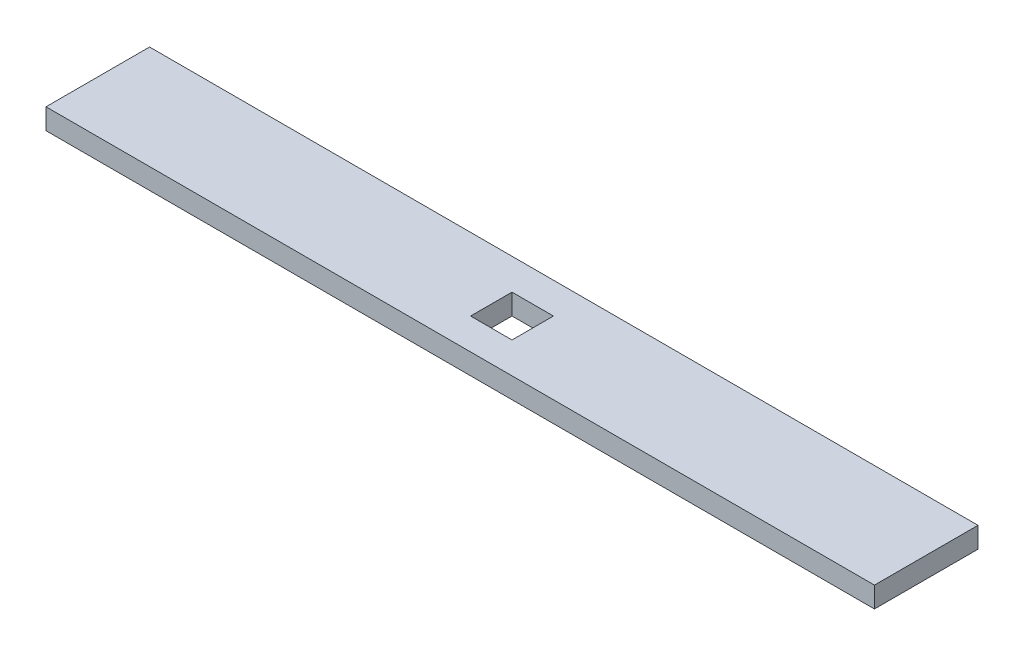
from build123d import *

# Parameters (mm, degrees)
SKETCH2_W               = 20
SKETCH2_H               = 2.5
BOSS_EXTRUDE1_DEPTH     = 0.5
CUT_EXTRUDE1_DEPTH      = 11.090218035
CUT_EXTRUDE1_DEPTH_BACK = 11.090218035
SKETCH3_R               = 0.5
SKETCH3_W               = 1
SKETCH3_H               = 1


with BuildPart() as part:
    # Sketch2 → Boss-Extrude1 (new body)
    with BuildSketch(Plane(origin=(0, 0, 0), x_dir=(1, 0, 0), z_dir=(0, 1, 0))):
        Rectangle(SKETCH2_W, SKETCH2_H)
    extrude(amount=BOSS_EXTRUDE1_DEPTH)

    # Sketch3 → Cut-Extrude1 (cut, two sides: drawn at the far end of the back side and taken through both)
    with BuildSketch(Plane(origin=(0, 0.5, 0), x_dir=(1, 0, 0), z_dir=(0, 1, 0)).offset(-CUT_EXTRUDE1_DEPTH_BACK)):
        with Locations((-13.5, 0)):
            Circle(SKETCH3_R)
        with Locations((13.5, 0)):
            Circle(SKETCH3_R)
        Rectangle(SKETCH3_W, SKETCH3_H)
    extrude(amount=CUT_EXTRUDE1_DEPTH + CUT_EXTRUDE1_DEPTH_BACK, mode=Mode.SUBTRACT)


solid = part.part
